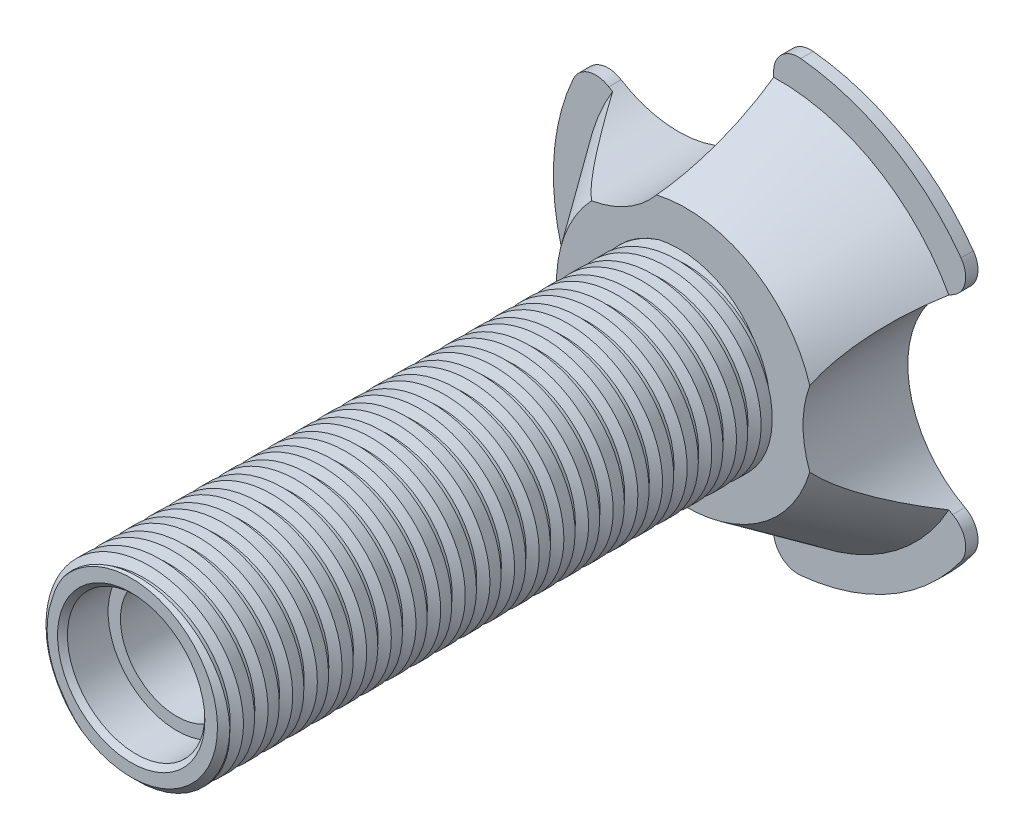
from build123d import *

# Parameters (mm, degrees)
SKETCH_1_R          = 15
EXTRUDE_1_DEPTH     = 90
SKETCH_2_R          = 21
EXTRUDE_2_DEPTH     = 15
EXTRUDE_2_DRAFT     = -35
SKETCH_6_R          = 36.503113073
EXTRUDE_3_DEPTH     = 2
SKETCH_7_R          = 17.5
CUT_EXTRUDE_1_DEPTH = 119.802165502
FILLET_1_R          = 4
CHAMFER_1_SIZE      = 1
THREAD_1_PITCH      = 4
THREAD_1_TO         = 99
SKETCH_8_R          = 11.15
CUT_EXTRUDE_2_DEPTH = 7.4
CUT_EXTRUDE_START   = -7.4
SKETCH_9_R          = 11.15
CUT_EXTRUDE_3_DEPTH = 7.4
CHAMFER_2_SIZE      = 0.8
SKETCH_10_R         = 9.15
CUT_EXTRUDE_4_DEPTH = 113.130951869


with BuildPart() as part:
    # Sketch 1 → Бобышка-Вытянуть1 (new body)
    with BuildSketch(Plane.XY):
        with Locations(Location((0, 0, 0), (0, 0, 180))):
            Circle(SKETCH_1_R)
    extrude(amount=EXTRUDE_1_DEPTH)


with BuildPart() as extrude_2_tool:
    # Эскиз2 → Бобышка-Вытянуть2 (with draft: the straight prism first)
    with BuildSketch(Plane(origin=(0, 0, 0), x_dir=(-1, 0, 0), z_dir=(0, 0, -1))):
        Circle(SKETCH_2_R)
    extrude(amount=EXTRUDE_2_DEPTH)
    # Бобышка-Вытянуть2: the draft: its side faces are tilted about the plane it starts from
    extrude_2_sides = [extrude_2_tool.faces().sort_by_distance(p)[0] for p in [
        (21, 0, -7.5),
    ]]
    draft(extrude_2_sides, Plane(origin=(0, 0, 0), x_dir=(-1, 0, 0), z_dir=(0, 0, -1)), EXTRUDE_2_DRAFT)


with BuildPart() as part_1:
    add(part.part)

    # Бобышка-Вытянуть2: add extrude_2_tool
    add(extrude_2_tool.part)

    # Эскиз6 → Бобышка-Вытянуть3 (add)
    with BuildSketch(Plane(origin=(0, 0, -15), x_dir=(-1, 0, 0), z_dir=(0, 0, -1))):
        Circle(SKETCH_6_R)
    extrude(amount=EXTRUDE_3_DEPTH)

    # Эскиз7 → Вырез-Вытянуть1 (cut, through all)
    with BuildSketch(Plane(origin=(0, 0, -17), x_dir=(-1, 0, 0), z_dir=(0, 0, -1))):
        with Locations((-36.503113073, 0)):
            Circle(SKETCH_7_R)
        with Locations((18.251556537, 31.612623239)):
            Circle(SKETCH_7_R)
        with Locations((18.251556537, -31.612623239)):
            Circle(SKETCH_7_R)
    extrude(amount=-CUT_EXTRUDE_1_DEPTH, mode=Mode.SUBTRACT)

    # Скругление1
    fillet_1_edges = [part_1.edges().sort_by_distance(p)[0] for p in [
        (32.308265371, 16.989798491, -16),
        (32.308265371, -16.989798491, -16),
        (-1.440535587, 36.474677809, -16),
        (-30.867729784, 19.484879318, -16),
        (-30.867729784, -19.484879318, -16),
        (-1.440535587, -36.474677809, -16),
    ]]
    fillet(fillet_1_edges, radius=FILLET_1_R)

    # Фаска1
    chamfer_1_edges = [part_1.edges().sort_by_distance(p)[0] for p in [
        (15, 0, 90),
    ]]
    chamfer(chamfer_1_edges, length=CHAMFER_1_SIZE)

    # Резьба1: arcs per turn and ends read off the stored shape
    # Резьба1: the profile of Sketch 1 2 profile screwed along a right-hand helix through 24.75 turns, 12 arcs to a turn; built about Z, then put on its axis
    thread_1_z = Axis((0, 0, 0), (0, 0, 1))
    thread_1_corners = [(15.0003, 0, -0.000173205), (15.0003, 0, 2.187673198), (13.646835313, 0, 1.406249997), (13.646835313, 0, 0.781249997)]
    with BuildLine(mode=Mode.PRIVATE) as thread_1_profile:
        Line(thread_1_corners[0], thread_1_corners[1])
        Line(thread_1_corners[1], thread_1_corners[2])
        Line(thread_1_corners[2], thread_1_corners[3])
        Line(thread_1_corners[3], thread_1_corners[0])
    thread_1_cap = Face(thread_1_profile.wire())
    thread_1_turn_angles = [0, 15, 30, 45, 60, 75, 90, 105, 120, 135, 150, 165, 180, 195, 210, 225, 240, 255, 270, 285, 300, 315, 330, 345, 360]
    thread_1_turn_weights = [1, 0.9659258262890683, 1, 0.9659258262890683, 1, 0.9659258262890683, 1, 0.9659258262890683, 1, 0.9659258262890683, 1, 0.9659258262890683, 1, 0.9659258262890683, 1, 0.9659258262890683, 1, 0.9659258262890683, 1, 0.9659258262890683, 1, 0.9659258262890683, 1, 0.9659258262890683, 1]
    thread_1_turn_rails = [Edge.make_bspline([Vector(p[0], p[1], 0).rotate(thread_1_z, thread_1_turn_angles[k]) / thread_1_turn_weights[k] + Vector(0, 0, p[2] + THREAD_1_PITCH * thread_1_turn_angles[k] / 360) for k in range(25)], [0, 0, 0, 1, 1, 2, 2, 3, 3, 4, 4, 5, 5, 6, 6, 7, 7, 8, 8, 9, 9, 10, 10, 11, 11, 12, 12, 12], 2, thread_1_turn_weights) for p in thread_1_corners]
    thread_1_turn_sides = [Face.make_surface_from_curves(thread_1_turn_rails[p[0]], thread_1_turn_rails[p[1]]) for p in [(0, 1), (1, 2), (2, 3), (3, 0)]]
    thread_1_last_angles = [8640, 8655, 8670, 8685, 8700, 8715, 8730, 8745, 8760, 8775, 8790, 8805, 8820, 8835, 8850, 8865, 8880, 8895, 8910]
    thread_1_last_weights = [1, 0.9659258262890683, 1, 0.9659258262890683, 1, 0.9659258262890683, 1, 0.9659258262890683, 1, 0.9659258262890683, 1, 0.9659258262890683, 1, 0.9659258262890683, 1, 0.9659258262890683, 1, 0.9659258262890601, 1]
    thread_1_last_rails = [Edge.make_bspline([Vector(p[0], p[1], 0).rotate(thread_1_z, thread_1_last_angles[k]) / thread_1_last_weights[k] + Vector(0, 0, p[2] + THREAD_1_PITCH * thread_1_last_angles[k] / 360) for k in range(19)], [0, 0, 0, 1, 1, 2, 2, 3, 3, 4, 4, 5, 5, 6, 6, 7, 7, 8, 8, 9, 9, 9], 2, thread_1_last_weights) for p in thread_1_corners]
    thread_1_last_sides = [Face.make_surface_from_curves(thread_1_last_rails[p[0]], thread_1_last_rails[p[1]]) for p in [(0, 1), (1, 2), (2, 3), (3, 0)]]
    thread_1 = Plane(origin=(0, 0, 99), x_dir=(-1, 0, 0), z_dir=(0, 0, -1)) * split(Solid(Shell([*[p.moved(Location((0, 0, THREAD_1_PITCH * i))) for i in range(24) for p in thread_1_turn_sides], *thread_1_last_sides, thread_1_cap, thread_1_cap.rotate(thread_1_z, 8910).moved(Location((0, 0, THREAD_1_PITCH * 8910 / 360)))])), bisect_by=Plane.XY.offset(THREAD_1_TO), keep=Keep.BOTTOM, mode=Mode.PRIVATE)
    add(thread_1, mode=Mode.SUBTRACT)

    # Эскиз8 → Вырез-Вытянуть2 (cut)
    with BuildSketch(Plane.XY.offset(90)):
        Circle(SKETCH_8_R)
    extrude(amount=-CUT_EXTRUDE_2_DEPTH, mode=Mode.SUBTRACT)

    # Эскиз9 → Вырез-Вытянуть3 (cut)
    with BuildSketch(Plane(origin=(0, 0, -17), x_dir=(-1, 0, 0), z_dir=(0, 0, -1)).offset(CUT_EXTRUDE_START)):
        with Locations(Location((0, 0, 0), (0, 0, 180))):
            Circle(SKETCH_9_R)
    extrude(amount=CUT_EXTRUDE_3_DEPTH, mode=Mode.SUBTRACT)

    # Фаска2
    chamfer_2_edges = [part_1.edges().sort_by_distance(p)[0] for p in [
        (-11.15, 0, 90),
        (-11.15, 0, -17),
    ]]
    chamfer(chamfer_2_edges, length=CHAMFER_2_SIZE)

    # Эскиз10 → Вырез-Вытянуть4 (cut, through all)
    with BuildSketch(Plane(origin=(0, 0, -9.6), x_dir=(-1, 0, 0), z_dir=(0, 0, -1))):
        Circle(SKETCH_10_R)
    extrude(amount=-CUT_EXTRUDE_4_DEPTH, mode=Mode.SUBTRACT)


solid = part_1.part
